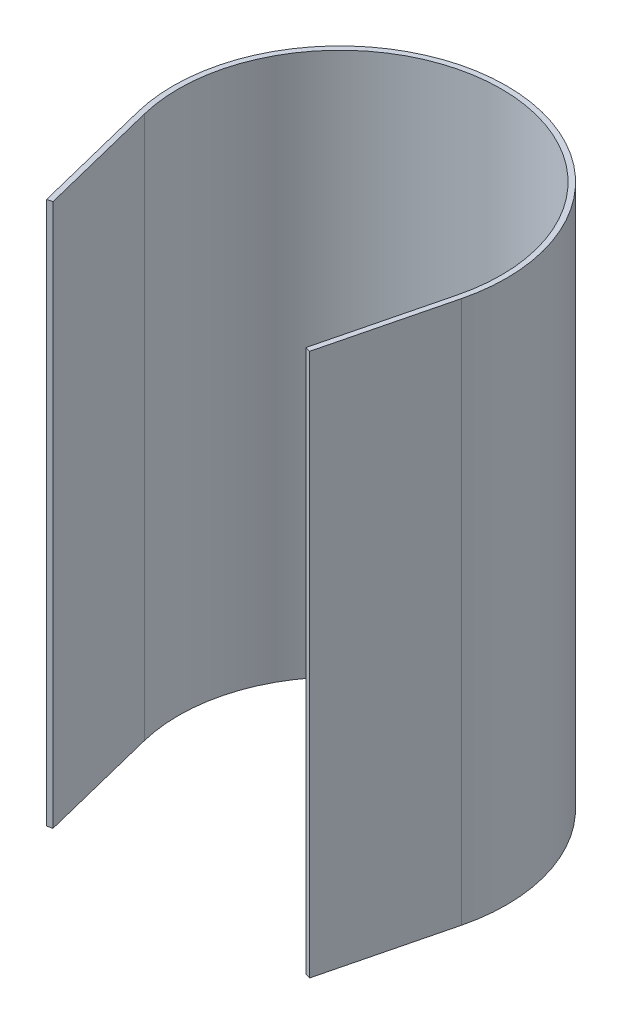
from build123d import *

# Parameters (mm, degrees)
ELECTRONICS_GLASS_EXTRUDE_DEPTH = 2050


with BuildPart() as part:
    # Electronics Glass Sketch → Electronics Glass Extrude (new body)
    with BuildSketch(Plane(origin=(0, 0, 0), x_dir=(1, 0, 0), z_dir=(0, 1, 0))):
        with BuildLine():
            Line((610.956620339, -152.07947943), (496.754184727, -610.87072699))
            Line((496.754184727, -610.87072699), (477.346414069, -606.039739715))
            Line((477.346414069, -606.039739715), (591.54884968, -147.248492154))
            ThreePointArc((591.54884968, -147.248492154), (605.070383825, -74.175404397), (609.6, 0))
            ThreePointArc((609.6, 0), (0, 609.6), (-609.6, 0))
            ThreePointArc((-609.6, 0), (-605.070383825, -74.175404397), (-591.54884968, -147.248492154))
            Line((-591.54884968, -147.248492154), (-477.346414069, -606.039739715))
            Line((-477.346414069, -606.039739715), (-496.754184727, -610.87072699))
            Line((-496.754184727, -610.87072699), (-610.956620339, -152.07947943))
            ThreePointArc((-610.956620339, -152.07947943), (0, 629.6), (610.956620339, -152.07947943))
        make_face()
    extrude(amount=ELECTRONICS_GLASS_EXTRUDE_DEPTH)


solid = part.part
